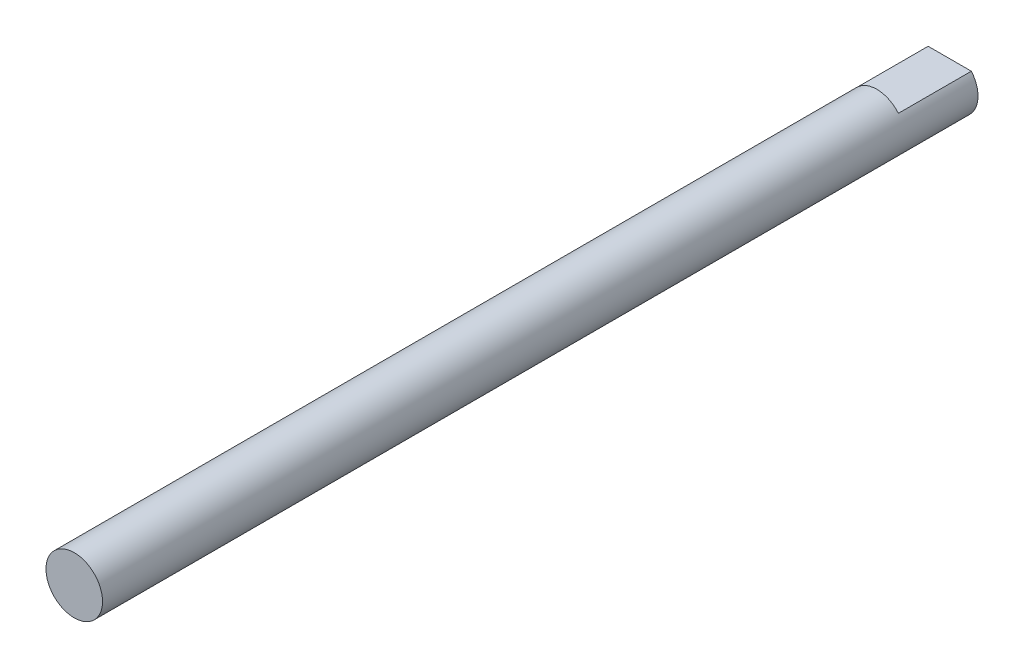
from build123d import *

# Parameters (mm, degrees)
SKETCH2_R           = 3.875
BOSS_EXTRUDE1_DEPTH = 120
CUT_EXTRUDE1_DEPTH  = 10


with BuildPart() as part:
    # Sketch2 → Boss-Extrude1 (new body)
    with BuildSketch(Plane.XY):
        Circle(SKETCH2_R)
    extrude(amount=BOSS_EXTRUDE1_DEPTH)

    # Sketch3 → Cut-Extrude1 (cut)
    with BuildSketch(Plane.XY):
        with BuildLine():
            Line((-2.960679821, 2.5), (2.960679821, 2.5))
            ThreePointArc((2.960679821, 2.5), (0, 3.875), (-2.960679821, 2.5))
        make_face()
    extrude(amount=CUT_EXTRUDE1_DEPTH, mode=Mode.SUBTRACT)


solid = part.part
